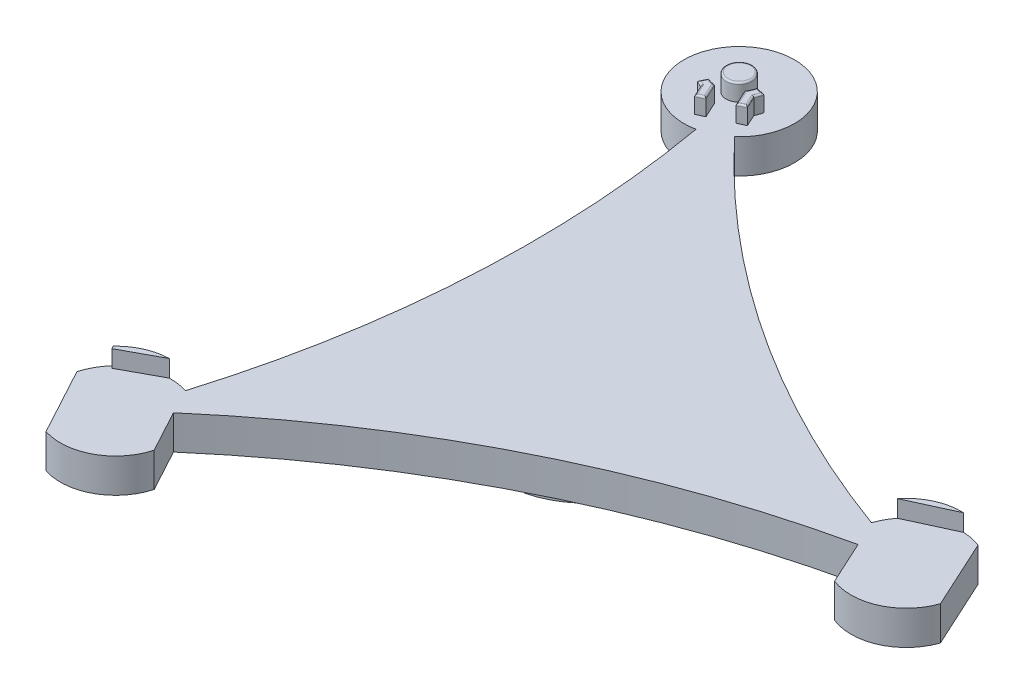
from build123d import *

# Parameters (mm, degrees)
SKETCH2_R           = 8.255
BOSS_EXTRUDE1_DEPTH = 5.08
CUT_EXTRUDE1_DEPTH  = 80.908377803
BOSS_EXTRUDE2_DEPTH = 5.08
SKETCH8_R           = 1.9365
BOSS_EXTRUDE4_DEPTH = 2.54
FILLET1_R           = 0.254


with BuildPart() as part:
    # Sketch2 → Boss-Extrude1 (new body)
    with BuildSketch(Plane(origin=(0, 0, 0), x_dir=(1, 0, 0), z_dir=(0, 1, 0))):
        with Locations((50.708736123, -3.043695253)):
            Circle(SKETCH2_R)
        with BuildLine():
            Line((-26.410198882, 52.820397765), (8.519418994, -17.038837989))
            ThreePointArc((8.519418994, -17.038837989), (29.111674539, -8.526738277), (50.708736123, -3.043695253))
            ThreePointArc((50.708736123, -3.043695253), (13.970978455, 13.668941274), (-17.231396722, 39.269465517))
            ThreePointArc((-17.231396722, 39.269465517), (-15.883780079, 50.066404858), (-26.410198882, 52.820397765))
        make_face()
    boss_extrude1 = extrude(amount=BOSS_EXTRUDE1_DEPTH)

    # Sketch5 → Cut-Extrude1 (cut, through all)
    with BuildSketch(Plane(origin=(0, 5.08, 0), x_dir=(1, 0, 0), z_dir=(0, 1, 0))):
        with BuildLine():
            Line((58.508737367, -5.746472638), (53.73227101, 4.637662817))
            ThreePointArc((53.73227101, 4.637662817), (58.208389507, 0.405974894), (58.508737367, -5.746472638))
        make_face()
        with BuildLine():
            Line((47.685201237, -10.725053322), (44.702333378, -4.240237651))
            ThreePointArc((44.702333378, -4.240237651), (43.662385588, -4.472512868), (42.624053092, -4.711905455))
            ThreePointArc((42.624053092, -4.711905455), (44.393072013, -8.359465362), (47.685201237, -10.725053322))
        make_face()
    cut_extrude1 = extrude(amount=-CUT_EXTRUDE1_DEPTH, mode=Mode.SUBTRACT)

    # Mirror4: Boss-Extrude1, Cut-Extrude1 across plane
    add(boss_extrude1.mirror(Plane(origin=(0, 5.08, 0), x_dir=(0.4472135954999568, 0, 0.8944271909999164), z_dir=(0.8944271909999165, 0, -0.4472135954999568))))
    add(cut_extrude1.mirror(Plane(origin=(0, 5.08, 0), x_dir=(0.4472135954999568, 0, 0.8944271909999164), z_dir=(0.8944271909999165, 0, -0.4472135954999568))), mode=Mode.SUBTRACT)

    # Sketch3 → Boss-Extrude2 (add)
    with BuildSketch(Plane.XZ):
        with BuildLine():
            Line((-7.830396175, 9.998744708), (-4.996450265, 6.571187849))
            ThreePointArc((-4.996450265, 6.571187849), (-1.978896677, 8.01429928), (1.363556525, 8.141605407))
            Line((1.363556525, 8.141605407), (2.276392011, 12.494320286))
            ThreePointArc((2.276392011, 12.494320286), (-3.044456426, 12.329691199), (-7.830396175, 9.998744708))
        make_face()
        with BuildLine():
            Line((2.935161238, 12.356165607), (2.022325752, 8.003450728))
            ThreePointArc((2.022325752, 8.003450728), (2.873803437, 7.738622539), (3.691748231, 7.383496462))
            Line((3.691748231, 7.383496462), (5.679612663, 11.359225326))
            ThreePointArc((5.679612663, 11.359225326), (4.336133626, 11.936831455), (2.935161238, 12.356165607))
        make_face()
        with BuildLine():
            ThreePointArc((3.691748231, 7.383496462), (5.70850704, 5.963050593), (7.215527013, 4.010136523))
            Line((7.215527013, 4.010136523), (11.187760156, 6.010326339))
            ThreePointArc((11.187760156, 6.010326339), (8.847584221, 9.110996293), (5.679612663, 11.359225326))
            Line((5.679612663, 11.359225326), (3.691748231, 7.383496462))
        make_face()
        with BuildLine():
            ThreePointArc((8.255, 0), (8.09827691, -1.600917263), (7.63405849, -3.141046955))
            Line((7.63405849, -3.141046955), (11.674516714, -4.99956593))
            ThreePointArc((11.674516714, -4.99956593), (12.440987949, -2.551826574), (12.7, 0))
            ThreePointArc((12.7, 0), (12.39393251, 2.771360123), (11.490482373, 5.409141784))
            Line((11.490482373, 5.409141784), (7.51824923, 3.408951968))
            ThreePointArc((7.51824923, 3.408951968), (8.068710318, 1.743828777), (8.255, 0))
        make_face()
        with BuildLine():
            Line((11.393235918, -5.611076129), (7.352777693, -3.752557154))
            ThreePointArc((7.352777693, -3.752557154), (5.260198437, -6.362023059), (2.303988218, -7.92695801))
            Line((2.303988218, -7.92695801), (3.370124071, -12.244683081))
            ThreePointArc((3.370124071, -12.244683081), (8.092612979, -9.787727784), (11.393235918, -5.611076129))
        make_face()
        with BuildLine():
            Line((2.716650437, -12.406039271), (1.650514584, -8.088314201))
            ThreePointArc((1.650514584, -8.088314201), (-1.07974567, -8.18408054), (-3.691748231, -7.383496462))
            Line((-3.691748231, -7.383496462), (-5.679612663, -11.359225326))
            ThreePointArc((-5.679612663, -11.359225326), (-1.571222819, -12.602430672), (2.716650437, -12.406039271))
        make_face()
        with BuildLine():
            Line((-5.679612663, -11.359225326), (-3.691748231, -7.383496462))
            ThreePointArc((-3.691748231, -7.383496462), (-4.238479263, -7.083806783), (-4.761032175, -6.743708003))
            Line((-4.761032175, -6.743708003), (-7.472040736, -10.269304126))
            ThreePointArc((-7.472040736, -10.269304126), (-6.598369408, -10.851337298), (-5.679612663, -11.359225326))
        make_face()
        with BuildLine():
            Line((-8.005628232, -9.859001806), (-5.294619671, -6.333405683))
            ThreePointArc((-5.294619671, -6.333405683), (-7.373018127, -3.712630966), (-8.240898233, -0.482308323))
            Line((-8.240898233, -0.482308323), (-12.687606467, -0.560929709))
            ThreePointArc((-12.687606467, -0.560929709), (-11.343104811, -5.711739948), (-8.005628232, -9.859001806))
        make_face()
        with BuildLine():
            Line((-12.699505558, 0.112065107), (-8.252797323, 0.190686492))
            ThreePointArc((-8.252797323, 0.190686492), (-7.499653384, 3.449670147), (-5.515199838, 6.142279361))
            Line((-5.515199838, 6.142279361), (-8.349145748, 9.56983622))
            ThreePointArc((-8.349145748, 9.56983622), (-11.537928283, 5.307184842), (-12.699505558, 0.112065107))
        make_face()
    extrude(amount=BOSS_EXTRUDE2_DEPTH)

    # Sketch8 → Boss-Extrude4 (add)
    with BuildSketch(Plane(origin=(0, 5.08, 0), x_dir=(1, 0, 0), z_dir=(0, 1, 0))):
        with Locations(Location((-22.718450651, 45.436901303, 0), (0, 0, 270))):
            Circle(SKETCH8_R)
        with BuildLine():
            Line((44.245017522, 2.091026438), (51.016120308, 5.205579865))
            ThreePointArc((51.016120308, 5.205579865), (47.259065976, 4.455958131), (44.245017522, 2.091026438))
        make_face()
        with BuildLine():
            Line((-28.219831663, -34.141398155), (-33.783449428, -37.153243515))
            Line((-33.783449428, -37.153243515), (-34.006657305, -36.740923771))
            ThreePointArc((-34.006657305, -36.740923771), (-31.372925912, -34.863081971), (-28.219831663, -34.141398155))
        make_face()
        with BuildLine():
            Line((-23.106493475, 39.17694603), (-23.920173634, 40.945903321))
            ThreePointArc((-23.920173634, 40.945903321), (-24.338189112, 41.07918994), (-24.741778068, 41.25128938))
            Line((-24.741778068, 41.25128938), (-24.189051499, 42.394702403))
            ThreePointArc((-24.189051499, 42.394702403), (-23.62923703, 42.182963815), (-23.040846879, 42.073316657))
            Line((-23.040846879, 42.073316657), (-21.952700646, 39.707664514))
            Line((-21.952700646, 39.707664514), (-23.106493475, 39.17694603))
        make_face()
        with BuildLine():
            Line((-18.155964663, 44.544196083), (-19.402331023, 44.788062641))
            ThreePointArc((-19.402331023, 44.788062641), (-19.610293029, 44.111383595), (-19.954678188, 43.49288413))
            Line((-19.954678188, 43.49288413), (-18.866531955, 41.127231987))
            Line((-18.866531955, 41.127231987), (-17.712739127, 41.657950471))
            Line((-17.712739127, 41.657950471), (-18.526419286, 43.426907762))
            ThreePointArc((-18.526419286, 43.426907762), (-18.305687705, 43.97377992), (-18.155964663, 44.544196083))
        make_face()
    extrude(amount=BOSS_EXTRUDE4_DEPTH)

    # Fillet1
    # the kernel refuses this fillet: 0.254 mm, written as the material it takes off along each edge
    with BuildSketch(Plane(origin=(-22.718450651, 7.62, -45.436901303), x_dir=(0, 0, 1), z_dir=(-1, 0, 0))) as fillet1_piece_1:
        with BuildLine():
            CenterArc((1.9365 - FILLET1_R, -FILLET1_R), FILLET1_R, 0, 90)
            Line((1.9365 - FILLET1_R, 0), (1.9365, 0))
            Line((1.9365, 0), (1.9365, -FILLET1_R))
        make_face()
    revolve(axis=Axis((-22.718450651, 7.62, -45.436901303), (0, 1, 0)), mode=Mode.SUBTRACT)
    with BuildSketch(Plane(origin=(-22.718450651, 7.62, -45.436901303), x_dir=(0.8344364668114368, 0, 0.5511041488278291), z_dir=(-0.5511041488278291, 0, 0.8344364668114368))) as fillet1_piece_2_section:
        with BuildLine():
            CenterArc((4.649 - FILLET1_R, -FILLET1_R), FILLET1_R, 0, 90)
            Line((4.649 - FILLET1_R, 0), (4.649, 0))
            Line((4.649, 0), (4.649, -FILLET1_R))
        make_face()
    fillet1_piece_2 = revolve(axis=Axis((-22.718450651, 7.62, -45.436901303), (0, 1, 0)), revolution_arc=30.198076812, mode=Mode.PRIVATE)
    fillet1_piece_2 = split(fillet1_piece_2, bisect_by=Plane(origin=(-18.824875628, 7.561246822, -44.075757948), z_dir=(0.9084982899729419, 0, -0.4178885702148846)), keep=Keep.TOP, mode=Mode.PRIVATE)
    add(fillet1_piece_2, mode=Mode.SUBTRACT)
    with BuildSketch(Plane(origin=(-19.44342837, 7.62, -40.861872745), x_dir=(0, -1, 0), z_dir=(0.9084982899729457, 0, -0.4178885702148762)), Plane(origin=(-17.532781484, 7.62, -44.422262804), x_dir=(0, -1, 0), z_dir=(-0.9813908341478762, 0, -0.19202091201360277))) as fillet1_piece_3:
        with BuildLine():
            CenterArc((FILLET1_R, FILLET1_R), FILLET1_R, 180, 90)
            Line((0, FILLET1_R), (0, 0))
            Line((0, 0), (FILLET1_R, 0))
        make_face()
    extrude(amount=2.54, mode=Mode.SUBTRACT)
    with BuildSketch(Plane(origin=(-22.718450651, 7.62, -45.436901303), x_dir=(0.9999860071665359, 0, 0.005290129594736052), z_dir=(0.005290129594736052, 0, -0.9999860071665359))) as fillet1_piece_4:
        with BuildLine():
            CenterArc((3.379 + FILLET1_R, FILLET1_R), FILLET1_R, 180, 90)
            Line((3.379 + FILLET1_R, 0), (3.379, 0))
            Line((3.379, 0), (3.379, FILLET1_R))
        make_face()
    revolve(axis=Axis((-22.718450651, 7.62, -45.436901303), (0, -1, 0)), revolution_arc=45.586809734, mode=Mode.SUBTRACT)
    with BuildSketch(Plane(origin=(-20.22003743, 7.62, -44.069780544), x_dir=(0, -1, 0), z_dir=(0.41788857021487913, 0, 0.9084982899729444))) as fillet1_piece_5:
        with BuildLine():
            CenterArc((FILLET1_R, FILLET1_R), FILLET1_R, 180, 90)
            Line((0, FILLET1_R), (0, 0))
            Line((0, 0), (FILLET1_R, 0))
        make_face()
    extrude(amount=3.873914799, mode=Mode.SUBTRACT)
    with BuildSketch(Plane(origin=(-17.447379885, 7.62, -41.081054057), x_dir=(0, -1, 0), z_dir=(-0.41788857021488457, 0, -0.9084982899729418))) as fillet1_piece_6_section:
        with BuildLine():
            CenterArc((FILLET1_R, FILLET1_R), FILLET1_R, 180, 90)
            Line((0, FILLET1_R), (0, 0))
            Line((0, 0), (FILLET1_R, 0))
        make_face()
    fillet1_piece_6 = extrude(amount=3.217122312, mode=Mode.PRIVATE)
    fillet1_piece_6 = fillet1_piece_6 - Plane(origin=(-22.718450651, 7.561939846, -45.436901303), x_dir=(0.9017060368272567, 0, 0.43234965380960144), z_dir=(0, -1, 0)) * Cylinder(4.649, 8, mode=Mode.PRIVATE)
    add(fillet1_piece_6, mode=Mode.SUBTRACT)
    with BuildSketch(Plane(origin=(-25.018141353, 7.62, -40.679582869), x_dir=(0, -1, 0), z_dir=(0.43521777087784447, 0, -0.9003252145264622)), Plane(origin=(-21.375804232, 7.62, -39.973023756), x_dir=(0, -1, 0), z_dir=(-0.9084982899729452, 0, 0.41788857021487724))) as fillet1_piece_7:
        with BuildLine():
            CenterArc((FILLET1_R, -FILLET1_R), FILLET1_R, 90, 90)
            Line((0, -FILLET1_R), (0, 0))
            Line((0, 0), (FILLET1_R, 0))
        make_face()
    extrude(amount=2.54, mode=Mode.SUBTRACT)
    with BuildSketch(Plane(origin=(-22.841134233, 7.62, -38.600049616), x_dir=(0, -1, 0), z_dir=(-0.41788857021487996, 0, -0.908498289972944))) as fillet1_piece_8_section:
        with BuildLine():
            CenterArc((FILLET1_R, -FILLET1_R), FILLET1_R, 90, 90)
            Line((0, -FILLET1_R), (0, 0))
            Line((0, 0), (FILLET1_R, 0))
        make_face()
    fillet1_piece_8 = extrude(amount=3.217122312, mode=Mode.PRIVATE)
    fillet1_piece_8 = fillet1_piece_8 - Plane(origin=(-22.718450651, 7.561939847, -45.436901303), x_dir=(-0.2584906393546377, 0, 0.9660137625137806), z_dir=(0, -1, 0)) * Cylinder(4.649, 8, mode=Mode.PRIVATE)
    add(fillet1_piece_8, mode=Mode.SUBTRACT)
    with BuildSketch(Plane(origin=(-23.306206121, 7.62, -42.650213071), x_dir=(0, -1, 0), z_dir=(0.4178885702148779, 0, 0.9084982899729449))) as fillet1_piece_9:
        with BuildLine():
            CenterArc((FILLET1_R, -FILLET1_R), FILLET1_R, 90, 90)
            Line((0, -FILLET1_R), (0, 0))
            Line((0, 0), (FILLET1_R, 0))
        make_face()
    extrude(amount=3.873914799, mode=Mode.SUBTRACT)
    with BuildSketch(Plane(origin=(-22.718450651, 7.62, -45.436901303), x_dir=(-0.5957582628036739, 0, 0.8031638016626176), z_dir=(-0.8031638016626176, 0, -0.5957582628036739))) as fillet1_piece_10:
        with BuildLine():
            CenterArc((3.379 + FILLET1_R, -FILLET1_R), FILLET1_R, 90, 90)
            Line((3.379 + FILLET1_R, 0), (3.379, 0))
            Line((3.379, 0), (3.379, -FILLET1_R))
        make_face()
    revolve(axis=Axis((-22.718450651, 7.62, -45.436901303), (0, 1, 0)), revolution_arc=41.859242164, mode=Mode.SUBTRACT)
    with BuildSketch(Plane(origin=(-22.718450651, 7.62, -45.436901303), x_dir=(-0.12454585215970877, 0, 0.9922138533148043), z_dir=(0.9922138533148043, 0, 0.12454585215970877))) as fillet1_piece_11_section:
        with BuildLine():
            CenterArc((4.649 - FILLET1_R, FILLET1_R), FILLET1_R, 270, 90)
            Line((4.649 - FILLET1_R, 0), (4.649, 0))
            Line((4.649, 0), (4.649, FILLET1_R))
        make_face()
    fillet1_piece_11 = revolve(axis=Axis((-22.718450651, 7.62, -45.436901303), (0, -1, 0)), revolution_arc=26.47061248, mode=Mode.PRIVATE)
    fillet1_piece_11 = split(fillet1_piece_11, bisect_by=Plane(origin=(-24.16845647, 7.561068538, -41.485675279), z_dir=(-0.908498289972944, 0, 0.41788857021487996)), keep=Keep.TOP, mode=Mode.PRIVATE)
    add(fillet1_piece_11, mode=Mode.SUBTRACT)
    with BuildSketch(Plane(origin=(-17.447379885, 7.62, -41.081054057), x_dir=(0, -1, 0), z_dir=(-0.41788857021488457, 0, -0.9084982899729418))) as fillet1_piece_12a_section:
        with BuildLine():
            CenterArc((FILLET1_R, FILLET1_R), FILLET1_R, 180, 90)
            Line((0, FILLET1_R), (0, 0))
            Line((0, 0), (FILLET1_R, 0))
        make_face()
    fillet1_piece_12a = extrude(amount=3.217122312, mode=Mode.PRIVATE)
    fillet1_piece_12a = fillet1_piece_12a & Plane(origin=(-22.718450651, 7.564564402, -45.436901303), x_dir=(0.9017060368272567, 0, 0.43234965380960144), z_dir=(0, -1, 0)) * Cylinder(4.649, 8, mode=Mode.PRIVATE)
    with BuildSketch(Plane(origin=(-22.718450651, 7.62, -45.436901303), x_dir=(0.8344364668114368, 0, 0.5511041488278291), z_dir=(-0.5511041488278291, 0, 0.8344364668114368))) as fillet1_piece_12b_section:
        with BuildLine():
            CenterArc((4.649 - FILLET1_R, -FILLET1_R), FILLET1_R, 0, 90)
            Line((4.649 - FILLET1_R, 0), (4.649, 0))
            Line((4.649, 0), (4.649, -FILLET1_R))
        make_face()
    fillet1_piece_12b = revolve(axis=Axis((-22.718450651, 7.62, -45.436901303), (0, 1, 0)), revolution_arc=30.198076812, mode=Mode.PRIVATE)
    fillet1_piece_12b = split(fillet1_piece_12b, bisect_by=Plane(origin=(-18.473467876, 7.564339835, -43.311790315), z_dir=(-0.9084982899729419, 0, 0.4178885702148846)), keep=Keep.TOP, mode=Mode.PRIVATE)
    fillet1_piece_12 = fillet1_piece_12a & fillet1_piece_12b
    add(fillet1_piece_12, mode=Mode.SUBTRACT)
    with BuildSketch(Plane(origin=(-22.718450651, 7.62, -45.436901303), x_dir=(-0.12454585215970877, 0, 0.9922138533148043), z_dir=(0.9922138533148043, 0, 0.12454585215970877))) as fillet1_piece_13a_section:
        with BuildLine():
            CenterArc((4.649 - FILLET1_R, FILLET1_R), FILLET1_R, 270, 90)
            Line((4.649 - FILLET1_R, 0), (4.649, 0))
            Line((4.649, 0), (4.649, FILLET1_R))
        make_face()
    fillet1_piece_13a = revolve(axis=Axis((-22.718450651, 7.62, -45.436901303), (0, -1, 0)), revolution_arc=26.47061248, mode=Mode.PRIVATE)
    fillet1_piece_13a = split(fillet1_piece_13a, bisect_by=Plane(origin=(-23.86722258, 7.564339845, -40.830786649), z_dir=(0.908498289972944, 0, -0.41788857021487996)), keep=Keep.TOP, mode=Mode.PRIVATE)
    with BuildSketch(Plane(origin=(-22.841134233, 7.62, -38.600049616), x_dir=(0, -1, 0), z_dir=(-0.41788857021487996, 0, -0.908498289972944))) as fillet1_piece_13b_section:
        with BuildLine():
            CenterArc((FILLET1_R, -FILLET1_R), FILLET1_R, 90, 90)
            Line((0, -FILLET1_R), (0, 0))
            Line((0, 0), (FILLET1_R, 0))
        make_face()
    fillet1_piece_13b = extrude(amount=3.217122312, mode=Mode.PRIVATE)
    fillet1_piece_13b = fillet1_piece_13b & Plane(origin=(-22.718450651, 7.564564403, -45.436901303), x_dir=(-0.2584906393546377, 0, 0.9660137625137806), z_dir=(0, -1, 0)) * Cylinder(4.649, 8, mode=Mode.PRIVATE)
    fillet1_piece_13 = fillet1_piece_13a & fillet1_piece_13b
    add(fillet1_piece_13, mode=Mode.SUBTRACT)


solid = part.part
